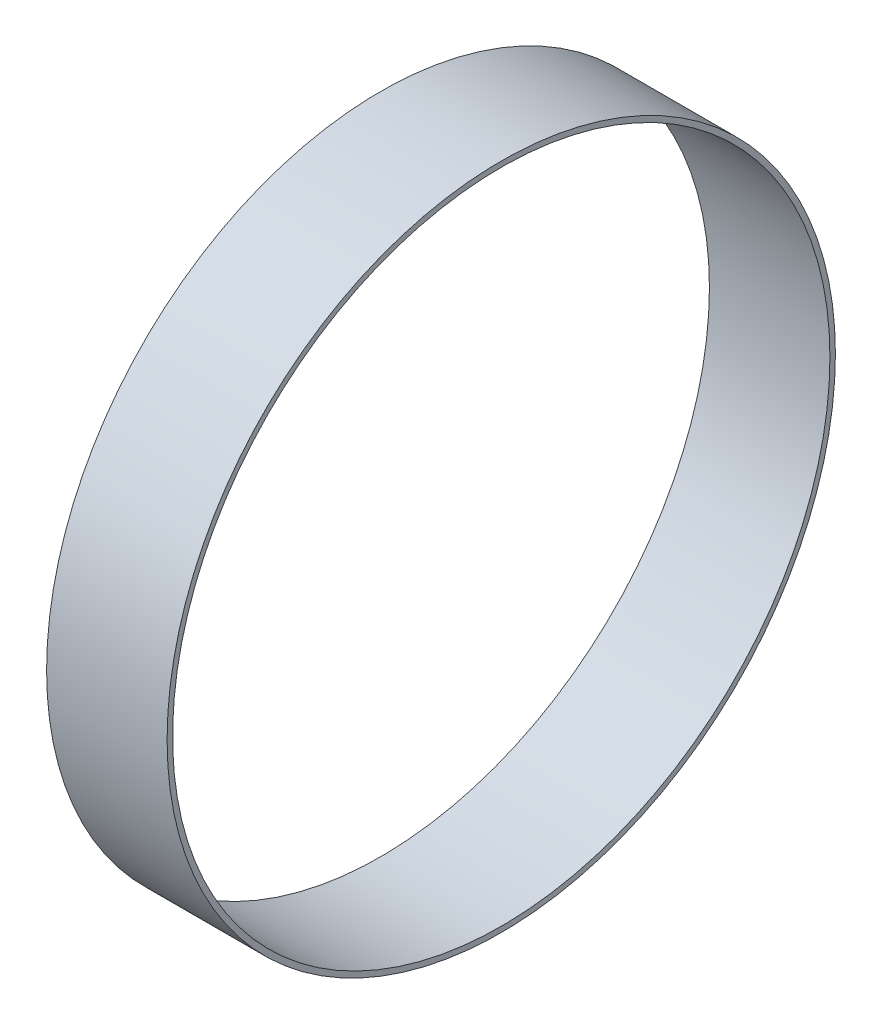
from build123d import *

# Parameters (mm, degrees)
SKETCH1_R           = 193.675
SKETCH1_R_2         = 190.5
BOSS_EXTRUDE1_DEPTH = 69.85


with BuildPart() as part:
    # Sketch1 → Boss-Extrude1 (new body)
    with BuildSketch(Plane(origin=(0, 0, 0), x_dir=(0, 0, -1), z_dir=(1, 0, 0))):
        Circle(SKETCH1_R)
        Circle(SKETCH1_R_2, mode=Mode.SUBTRACT)
    extrude(amount=BOSS_EXTRUDE1_DEPTH)


solid = part.part
